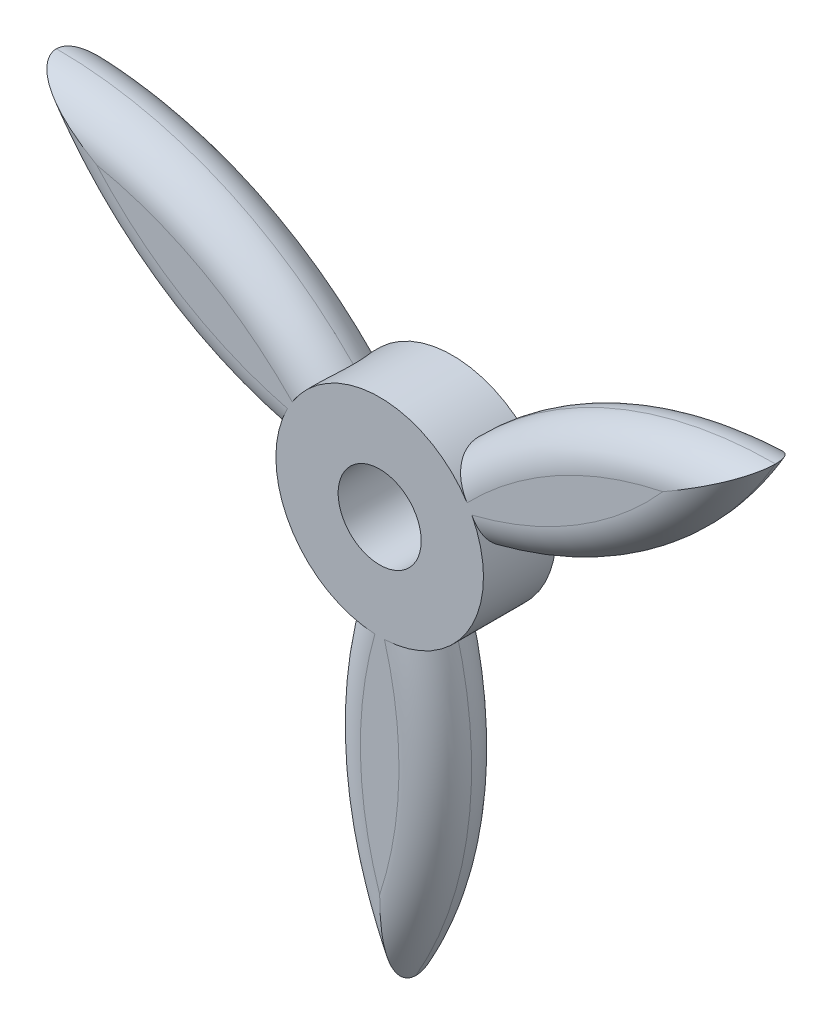
from build123d import *

# Parameters (mm, degrees)
SKETCH1_R           = 4
BOSS_EXTRUDE1_DEPTH = 7
FILLET2_R           = 3.5


with BuildPart() as part:
    # Sketch1 → Boss-Extrude1 (new body)
    with BuildSketch(Plane.XY):
        with BuildLine():
            ThreePointArc((-9.921567416, 1.25), (-8.660254038, -5), (-3.878251954, -9.217329428))
            ThreePointArc((-3.878251954, -9.217329428), (-5.045253515, -25), (0, -40))
            ThreePointArc((0, -40), (5.045253515, -25), (3.878251954, -9.217329428))
            ThreePointArc((3.878251954, -9.217329428), (8.660254038, -5), (9.921567416, 1.25))
            ThreePointArc((9.921567416, 1.25), (24.173261852, 8.130682288), (34.641016151, 20))
            ThreePointArc((34.641016151, 20), (19.128008337, 16.869317712), (6.043315463, 7.967329428))
            ThreePointArc((6.043315463, 7.967329428), (0, 10), (-6.043315463, 7.967329428))
            ThreePointArc((-6.043315463, 7.967329428), (-19.128008337, 16.869317712), (-34.641016151, 20))
            ThreePointArc((-34.641016151, 20), (-24.173261852, 8.130682288), (-9.921567416, 1.25))
        make_face()
        Circle(SKETCH1_R, mode=Mode.SUBTRACT)
    extrude(amount=BOSS_EXTRUDE1_DEPTH)

    # Fillet2
    fillet2_edges = [part.edges().sort_by_distance(p)[0] for p in [
        (-19.128008337, 16.869317712, 0),
        (-24.173261852, 8.130682288, 0),
        (19.128008337, 16.869317712, 0),
        (24.173261852, 8.130682288, 0),
        (5.045253515, -25, 0),
        (-5.045253515, -25, 0),
        (-5.045253515, -25, 7),
        (5.045253515, -25, 7),
        (24.173261852, 8.130682288, 7),
        (19.128008337, 16.869317712, 7),
        (-19.128008337, 16.869317712, 7),
        (-24.173261852, 8.130682288, 7),
    ]]
    fillet(fillet2_edges, radius=FILLET2_R - 0.0001)  # a hair under: the kernel refuses the full size


solid = part.part
